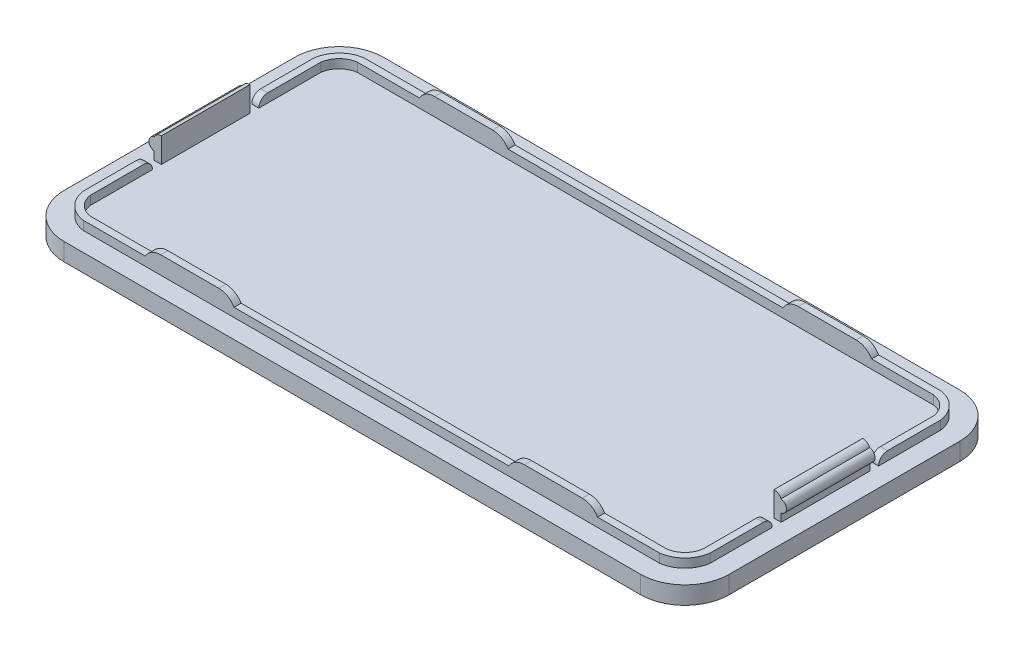
from build123d import *

# Parameters (mm, degrees)
EXTRUDE_2_DEPTH     = 2
EXTRUDE_4_DEPTH     = 1
SKETCH_7_W          = 0.8
SKETCH_7_H          = 10
EXTRUDE_8_DEPTH     = 2.8
SKETCH_8_R          = 0.7
EXTRUDE_9_DEPTH     = 10
FILLET_1_R          = 0.85
SKETCH_11_W         = 1
SKETCH_11_H         = 1
CUT_EXTRUDE_1_DEPTH = 1.2
FILLET_2_R          = 1
SKETCH_13_W         = 0.8
SKETCH_13_H         = 10
EXTRUDE_10_DEPTH    = 1.8
SKETCH_14_R         = 0.7
EXTRUDE_11_DEPTH    = 10
FILLET_3_R          = 0.85
SKETCH_15_W         = 0.8
SKETCH_15_H         = 1
CUT_EXTRUDE_3_DEPTH = 1
FILLET_4_R          = 1
EXTRUDE_START       = -2
EXTRUDE_12_DEPTH    = 2
CUT_EXTRUDE_START   = 2
CUT_EXTRUDE_4_DEPTH = 2
SKETCH_22_W         = 10
SKETCH_22_H         = 0.8
EXTRUDE_16_DEPTH    = 1
FILLET_5_R          = 2
SKETCH_23_R         = 2.39649891
EXTRUDE_18_DEPTH    = 2
FILLET_7_R          = 0.5


# Some blends are built 0.0001 mm under size
with BuildPart() as part:
    # case 2 → 凸台-拉伸2 (new body)
    with BuildSketch(Plane(origin=(0, 0, 0), x_dir=(1, 0, 0), z_dir=(0, 1, 0))):
        with BuildLine():
            Line((-34.042196447, 18), (30.957803553, 18))
            ThreePointArc((30.957803553, 18), (34.493337459, 16.535533906), (35.957803553, 13))
            Line((35.957803553, 13), (35.957803553, -13))
            ThreePointArc((35.957803553, -13), (34.493337459, -16.535533906), (30.957803553, -18))
            Line((30.957803553, -18), (-34.042196447, -18))
            ThreePointArc((-34.042196447, -18), (-37.577730353, -16.535533906), (-39.042196447, -13))
            Line((-39.042196447, -13), (-39.042196447, 13))
            ThreePointArc((-39.042196447, 13), (-37.577730353, 16.535533906), (-34.042196447, 18))
        make_face()
    extrude(amount=EXTRUDE_2_DEPTH)

    # 草图3 → 凸台-拉伸4 (add)
    with BuildSketch(Plane(origin=(0, 2, 0), x_dir=(1, 0, 0), z_dir=(0, 1, 0))):
        with BuildLine():
            Line((-36.892196447, 13), (-36.892196447, -13))
            ThreePointArc((-36.892196447, -13), (-35.952846076, -14.910649629), (-34.042196447, -15.85))
            Line((-34.042196447, -15.85), (30.957803553, -15.85))
            ThreePointArc((30.957803553, -15.85), (32.868453181, -14.910649629), (33.807803553, -13))
            Line((33.807803553, -13), (33.807803553, 13))
            ThreePointArc((33.807803553, 13), (32.868453181, 14.910649629), (30.957803553, 15.85))
            Line((30.957803553, 15.85), (-34.042196447, 15.85))
            ThreePointArc((-34.042196447, 15.85), (-35.952846076, 14.910649629), (-36.892196447, 13))
        make_face()
        with BuildLine():
            Line((-34.042196447, -15.05), (30.957803553, -15.05))
            ThreePointArc((30.957803553, -15.05), (32.327315928, -14.369512375), (33.007803553, -13))
            Line((33.007803553, -13), (33.007803553, 13))
            ThreePointArc((33.007803553, 13), (32.327315928, 14.369512375), (30.957803553, 15.05))
            Line((30.957803553, 15.05), (-34.042196447, 15.05))
            ThreePointArc((-34.042196447, 15.05), (-35.411708823, 14.369512375), (-36.092196447, 13))
            Line((-36.092196447, 13), (-36.092196447, -13))
            ThreePointArc((-36.092196447, -13), (-35.411708823, -14.369512375), (-34.042196447, -15.05))
        make_face(mode=Mode.SUBTRACT)
    extrude(amount=EXTRUDE_4_DEPTH)

    # 草图7 → 凸台-拉伸8 (add)
    with BuildSketch(Plane(origin=(0, 2, 0), x_dir=(1, 0, 0), z_dir=(0, 1, 0))):
        with Locations((-36.492196447, 0)):
            Rectangle(SKETCH_7_W, SKETCH_7_H)
    extrude(amount=EXTRUDE_8_DEPTH)

    # 草图8 → 凸台-拉伸9 (add)
    with BuildSketch(Plane.XY.offset(5)):
        with Locations((-36.792196447, 3.6)):
            Circle(SKETCH_8_R)
    extrude(amount=-EXTRUDE_9_DEPTH)

    # 圆角1
    # the kernel refuses this fillet: 0.85 mm, written as the material it takes off along each edge
    with BuildSketch(Plane(origin=(-36.892196447, 4.8, 6.944502228), x_dir=(0, -1, 0), z_dir=(0, 0, -1))) as fillet_1_piece_1:
        with BuildLine():
            CenterArc((0.85, -0.777800891), FILLET_1_R, 113.785768929, 66.214231071)
            Line((0, -0.777800891), (-0.017, -0.777800891))
            Line((-0.017, -0.777800891), (-0.017, 0))
            Line((-0.017, 0), (0, 0.017))
            ThreePointArc((0, 0.017), (0.253589838, 0.017), (0.500323271, 0.015556018))
            Line((0.500323271, 0.015556018), (0.507179677, 0))
        make_face()
    extrude(amount=13.889004455, mode=Mode.SUBTRACT)

    # 草图11 → 切除-拉伸1 (cut)
    with BuildSketch(Plane.ZY.offset(36.892196447)):
        with Locations((5.5, 2.5)):
            Rectangle(SKETCH_11_W, SKETCH_11_H)
        with Locations((-5.5, 2.5)):
            Rectangle(SKETCH_11_W, SKETCH_11_H)
    extrude(amount=-CUT_EXTRUDE_1_DEPTH, mode=Mode.SUBTRACT)

    # 圆角2
    fillet_2_edges = [part.edges().sort_by_distance(p)[0] for p in [
        (-36.492196447, 3, 6),
        (-36.492196447, 3, -6),
    ]]
    fillet(fillet_2_edges, radius=FILLET_2_R - 0.0001)  # a hair under: the kernel refuses the full size

    # 草图13 → 凸台-拉伸10 (add)
    with BuildSketch(Plane(origin=(0, 3, 0), x_dir=(1, 0, 0), z_dir=(0, 1, 0))):
        with Locations((33.407803553, 0)):
            Rectangle(SKETCH_13_W, SKETCH_13_H)
    extrude(amount=EXTRUDE_10_DEPTH)

    # 草图14 → 凸台-拉伸11 (add)
    with BuildSketch(Plane.XY.offset(5)):
        with Locations((33.707803553, 3.6)):
            Circle(SKETCH_14_R)
    extrude(amount=-EXTRUDE_11_DEPTH)

    # 圆角3
    # the kernel refuses this fillet: 0.85 mm, written as the material it takes off along each edge
    with BuildSketch(Plane(origin=(33.807803553, 4.8, -6.944502228), x_dir=(0, -1, 0), z_dir=(0, 0, 1))) as fillet_3_piece_1:
        with BuildLine():
            CenterArc((0.85, -0.777800891), FILLET_3_R, 113.785768929, 66.214231071)
            Line((0, -0.777800891), (-0.017, -0.777800891))
            Line((-0.017, -0.777800891), (-0.017, 0))
            Line((-0.017, 0), (0, 0.017))
            ThreePointArc((0, 0.017), (0.253589838, 0.017), (0.500323271, 0.015556018))
            Line((0.500323271, 0.015556018), (0.507179677, 0))
        make_face()
    extrude(amount=13.889004455, mode=Mode.SUBTRACT)

    # 草图15 → 切除-拉伸3 (cut)
    with BuildSketch(Plane(origin=(0, 3, 0), x_dir=(1, 0, 0), z_dir=(0, 1, 0))):
        with Locations((33.407803553, 5.5)):
            Rectangle(SKETCH_15_W, SKETCH_15_H)
        with Locations((33.407803553, -5.5)):
            Rectangle(SKETCH_15_W, SKETCH_15_H)
    extrude(amount=-CUT_EXTRUDE_3_DEPTH, mode=Mode.SUBTRACT)

    # 圆角4
    fillet_4_edges = [part.edges().sort_by_distance(p)[0] for p in [
        (33.407803553, 3, 6),
        (33.407803553, 3, -6),
    ]]
    fillet(fillet_4_edges, radius=FILLET_4_R - 0.0001)  # a hair under: the kernel refuses the full size

    # 草图2 → 凸台-拉伸12 (add)
    with BuildSketch(Plane(origin=(0, 0, 0), x_dir=(1, 0, 0), z_dir=(0, 1, 0)).offset(EXTRUDE_START)):
        with BuildLine():
            Line((33.807803553, -13), (33.807803553, 13))
            ThreePointArc((33.807803553, 13), (32.868453181, 14.910649629), (30.957803553, 15.85))
            Line((30.957803553, 15.85), (-34.042196447, 15.85))
            ThreePointArc((-34.042196447, 15.85), (-35.952846076, 14.910649629), (-36.892196447, 13))
            Line((-36.892196447, 13), (-36.892196447, -13))
            ThreePointArc((-36.892196447, -13), (-35.952846076, -14.910649629), (-34.042196447, -15.85))
            Line((-34.042196447, -15.85), (30.957803553, -15.85))
            ThreePointArc((30.957803553, -15.85), (32.868453181, -14.910649629), (33.807803553, -13))
        make_face()
        with BuildLine():
            Line((-34.042196447, -15.05), (30.957803553, -15.05))
            ThreePointArc((30.957803553, -15.05), (32.327315928, -14.369512375), (33.007803553, -13))
            Line((33.007803553, -13), (33.007803553, 13))
            ThreePointArc((33.007803553, 13), (32.327315928, 14.369512375), (30.957803553, 15.05))
            Line((30.957803553, 15.05), (-34.042196447, 15.05))
            ThreePointArc((-34.042196447, 15.05), (-35.411708823, 14.369512375), (-36.092196447, 13))
            Line((-36.092196447, 13), (-36.092196447, -13))
            ThreePointArc((-36.092196447, -13), (-35.411708823, -14.369512375), (-34.042196447, -15.05))
        make_face(mode=Mode.SUBTRACT)
    extrude(amount=EXTRUDE_12_DEPTH)

    # 草图20 → 切除-拉伸4 (cut)
    with BuildSketch(Plane.XZ.offset(CUT_EXTRUDE_START)):
        with BuildLine():
            Line((30.957803553, 15.85), (-34.042196447, 15.85))
            ThreePointArc((-34.042196447, 15.85), (-35.952846076, 14.910649629), (-36.892196447, 13))
            Line((-36.892196447, 13), (-36.892196447, -13))
            ThreePointArc((-36.892196447, -13), (-35.952846076, -14.910649629), (-34.042196447, -15.85))
            Line((-34.042196447, -15.85), (30.957803553, -15.85))
            ThreePointArc((30.957803553, -15.85), (32.868453181, -14.910649629), (33.807803553, -13))
            Line((33.807803553, -13), (33.807803553, 13))
            ThreePointArc((33.807803553, 13), (32.868453181, 14.910649629), (30.957803553, 15.85))
        make_face()
        with BuildLine():
            Line((-36.092196447, 13), (-36.092196447, -13))
            ThreePointArc((-36.092196447, -13), (-35.411708823, -14.369512375), (-34.042196447, -15.05))
            Line((-34.042196447, -15.05), (30.957803553, -15.05))
            ThreePointArc((30.957803553, -15.05), (32.327315928, -14.369512375), (33.007803553, -13))
            Line((33.007803553, -13), (33.007803553, 13))
            ThreePointArc((33.007803553, 13), (32.327315928, 14.369512375), (30.957803553, 15.05))
            Line((30.957803553, 15.05), (-34.042196447, 15.05))
            ThreePointArc((-34.042196447, 15.05), (-35.411708823, 14.369512375), (-36.092196447, 13))
        make_face(mode=Mode.SUBTRACT)
    extrude(amount=-CUT_EXTRUDE_4_DEPTH, mode=Mode.SUBTRACT)

    # 草图22 → 凸台-拉伸16 (add)
    with BuildSketch(Plane(origin=(0, 3, 0), x_dir=(1, 0, 0), z_dir=(0, 1, 0))):
        with Locations((-22.042196447, 15.45)):
            Rectangle(SKETCH_22_W, SKETCH_22_H)
        with Locations((18.957803553, 15.45)):
            Rectangle(SKETCH_22_W, SKETCH_22_H)
        with Locations((-22.042196447, -15.45)):
            Rectangle(SKETCH_22_W, SKETCH_22_H)
        with Locations((18.957803553, -15.45)):
            Rectangle(SKETCH_22_W, SKETCH_22_H)
    extrude(amount=EXTRUDE_16_DEPTH)

    # 圆角5
    # the kernel refuses this fillet: 2 mm, written as the material it takes off along each edge
    with BuildSketch(Plane(origin=(-27.042196447, 4, 20.180127019), x_dir=(0, -1, 0), z_dir=(0, 0, -1)), Plane(origin=(-17.042196447, 4, 10.719872981), x_dir=(0, -1, 0), z_dir=(0, 0, 1)), Plane(origin=(23.957803553, 4, 10.719872981), x_dir=(0, -1, 0), z_dir=(0, 0, 1)), Plane(origin=(23.957803553, 4, -20.180127019), x_dir=(0, -1, 0), z_dir=(0, 0, 1)), Plane(origin=(13.957803553, 4, -10.719872981), x_dir=(0, -1, 0), z_dir=(0, 0, -1)), Plane(origin=(-17.042196447, 4, -20.180127019), x_dir=(0, -1, 0), z_dir=(0, 0, 1)), Plane(origin=(-27.042196447, 4, -10.719872981), x_dir=(0, -1, 0), z_dir=(0, 0, -1))) as fillet_5_piece_1:
        with BuildLine():
            CenterArc((2, -1.732050808), FILLET_5_R, 120, 60)
            Line((0, -1.732050808), (-0.04, -1.732050808))
            Line((-0.04, -1.732050808), (-0.04, 0))
            Line((-0.04, 0), (0, 0.04))
            ThreePointArc((0, 0.04), (0.5, 0.04), (0.98, 0.034641016))
            Line((0.98, 0.034641016), (1, 0))
        make_face()
    extrude(amount=9.460254038, mode=Mode.SUBTRACT)
    with BuildSketch(Plane(origin=(13.957803553, 4, 20.180127019), x_dir=(1, 0, 0), z_dir=(0, 0, -1))) as fillet_5_piece_2:
        with BuildLine():
            CenterArc((1.732050808, 2), FILLET_5_R, 210, 60)
            Line((0, 1), (-0.034641016, 0.98))
            ThreePointArc((-0.034641016, 0.98), (-0.04, 0.5), (-0.04, 0))
            Line((-0.04, 0), (0, -0.04))
            Line((0, -0.04), (1.732050808, -0.04))
            Line((1.732050808, -0.04), (1.732050808, 0))
        make_face()
    extrude(amount=9.460254038, mode=Mode.SUBTRACT)

    # 草图23 → 凸台-拉伸18 (add)
    with BuildSketch(Plane.XZ):
        with Locations(Location((30.257803553, -11.925, 0), (0, 0, 90))):
            Circle(SKETCH_23_R)
        with Locations(Location((22.307803553, -11.925, 0), (0, 0, 90))):
            Circle(SKETCH_23_R)
        with Locations(Location((14.357803553, -11.925, 0), (0, 0, 90))):
            Circle(SKETCH_23_R)
        with Locations(Location((6.407803553, -11.925, 0), (0, 0, 90))):
            Circle(SKETCH_23_R)
        with Locations(Location((-1.542196447, -11.925, 0), (0, 0, 90))):
            Circle(SKETCH_23_R)
        with Locations(Location((-9.492196447, -11.925, 0), (0, 0, 90))):
            Circle(SKETCH_23_R)
        with Locations(Location((-17.442196447, -11.925, 0), (0, 0, 90))):
            Circle(SKETCH_23_R)
        with Locations(Location((-25.392196447, -11.925, 0), (0, 0, 90))):
            Circle(SKETCH_23_R)
        with Locations(Location((-33.342196447, -11.925, 0), (0, 0, 90))):
            Circle(SKETCH_23_R)
        with Locations(Location((22.307803553, -3.975, 0), (0, 0, 90))):
            Circle(SKETCH_23_R)
        with Locations(Location((14.357803553, -3.975, 0), (0, 0, 90))):
            Circle(SKETCH_23_R)
        with Locations(Location((6.407803553, -3.975, 0), (0, 0, 90))):
            Circle(SKETCH_23_R)
        with Locations(Location((-1.542196447, -3.975, 0), (0, 0, 90))):
            Circle(SKETCH_23_R)
        with Locations(Location((-9.492196447, -3.975, 0), (0, 0, 90))):
            Circle(SKETCH_23_R)
        with Locations(Location((-17.442196447, -3.975, 0), (0, 0, 90))):
            Circle(SKETCH_23_R)
        with Locations(Location((-25.392196447, -3.975, 0), (0, 0, 90))):
            Circle(SKETCH_23_R)
        with Locations(Location((-33.342196447, -3.975, 0), (0, 0, 90))):
            Circle(SKETCH_23_R)
        with Locations(Location((22.307803553, 3.975, 0), (0, 0, 90))):
            Circle(SKETCH_23_R)
        with Locations(Location((14.357803553, 3.975, 0), (0, 0, 90))):
            Circle(SKETCH_23_R)
        with Locations(Location((6.407803553, 3.975, 0), (0, 0, 90))):
            Circle(SKETCH_23_R)
        with Locations(Location((-1.542196447, 3.975, 0), (0, 0, 90))):
            Circle(SKETCH_23_R)
        with Locations(Location((-9.492196447, 3.975, 0), (0, 0, 90))):
            Circle(SKETCH_23_R)
        with Locations(Location((-17.442196447, 3.975, 0), (0, 0, 90))):
            Circle(SKETCH_23_R)
        with Locations(Location((-25.392196447, 3.975, 0), (0, 0, 90))):
            Circle(SKETCH_23_R)
        with Locations(Location((-33.342196447, 3.975, 0), (0, 0, 90))):
            Circle(SKETCH_23_R)
        with Locations(Location((22.307803553, 11.925, 0), (0, 0, 90))):
            Circle(SKETCH_23_R)
        with Locations(Location((14.357803553, 11.925, 0), (0, 0, 90))):
            Circle(SKETCH_23_R)
        with Locations(Location((6.407803553, 11.925, 0), (0, 0, 90))):
            Circle(SKETCH_23_R)
        with Locations(Location((-1.542196447, 11.925, 0), (0, 0, 90))):
            Circle(SKETCH_23_R)
        with Locations(Location((-9.492196447, 11.925, 0), (0, 0, 90))):
            Circle(SKETCH_23_R)
        with Locations(Location((-17.442196447, 11.925, 0), (0, 0, 90))):
            Circle(SKETCH_23_R)
        with Locations(Location((-25.392196447, 11.925, 0), (0, 0, 90))):
            Circle(SKETCH_23_R)
        with Locations(Location((-33.342196447, 11.925, 0), (0, 0, 90))):
            Circle(SKETCH_23_R)
        with Locations(Location((30.257803553, -3.975, 0), (0, 0, 90))):
            Circle(SKETCH_23_R)
        with Locations(Location((30.257803553, 3.975, 0), (0, 0, 90))):
            Circle(SKETCH_23_R)
        with Locations(Location((30.257803553, 11.925, 0), (0, 0, 90))):
            Circle(SKETCH_23_R)
    extrude(amount=EXTRUDE_18_DEPTH)

    # 圆角7
    fillet_7_edges = [part.edges().sort_by_distance(p)[0] for p in [
        (30.257803553, -2, -14.32149891),
        (22.307803553, -2, -14.32149891),
        (14.357803553, -2, -14.32149891),
        (6.407803553, -2, -14.32149891),
        (-1.542196447, -2, -14.32149891),
        (-9.492196447, -2, -14.32149891),
        (-17.442196447, -2, -14.32149891),
        (-25.392196447, -2, -14.32149891),
        (-33.342196447, -2, -14.32149891),
        (22.307803553, -2, -6.37149891),
        (14.357803553, -2, -6.37149891),
        (6.407803553, -2, -6.37149891),
        (-1.542196447, -2, -6.37149891),
        (-9.492196447, -2, -6.37149891),
        (-17.442196447, -2, -6.37149891),
        (-25.392196447, -2, -6.37149891),
        (-33.342196447, -2, -6.37149891),
        (22.307803553, -2, 1.57850109),
        (14.357803553, -2, 1.57850109),
        (6.407803553, -2, 1.57850109),
        (-1.542196447, -2, 1.57850109),
        (-9.492196447, -2, 1.57850109),
        (-17.442196447, -2, 1.57850109),
        (-25.392196447, -2, 1.57850109),
        (-33.342196447, -2, 1.57850109),
        (22.307803553, -2, 9.52850109),
        (14.357803553, -2, 9.52850109),
        (6.407803553, -2, 9.52850109),
        (-1.542196447, -2, 9.52850109),
        (-9.492196447, -2, 9.52850109),
        (-17.442196447, -2, 9.52850109),
        (-25.392196447, -2, 9.52850109),
        (-33.342196447, -2, 9.52850109),
        (30.257803553, -2, -6.37149891),
        (30.257803553, -2, 1.57850109),
        (30.257803553, -2, 9.52850109),
    ]]
    fillet(fillet_7_edges, radius=FILLET_7_R)


solid = part.part
